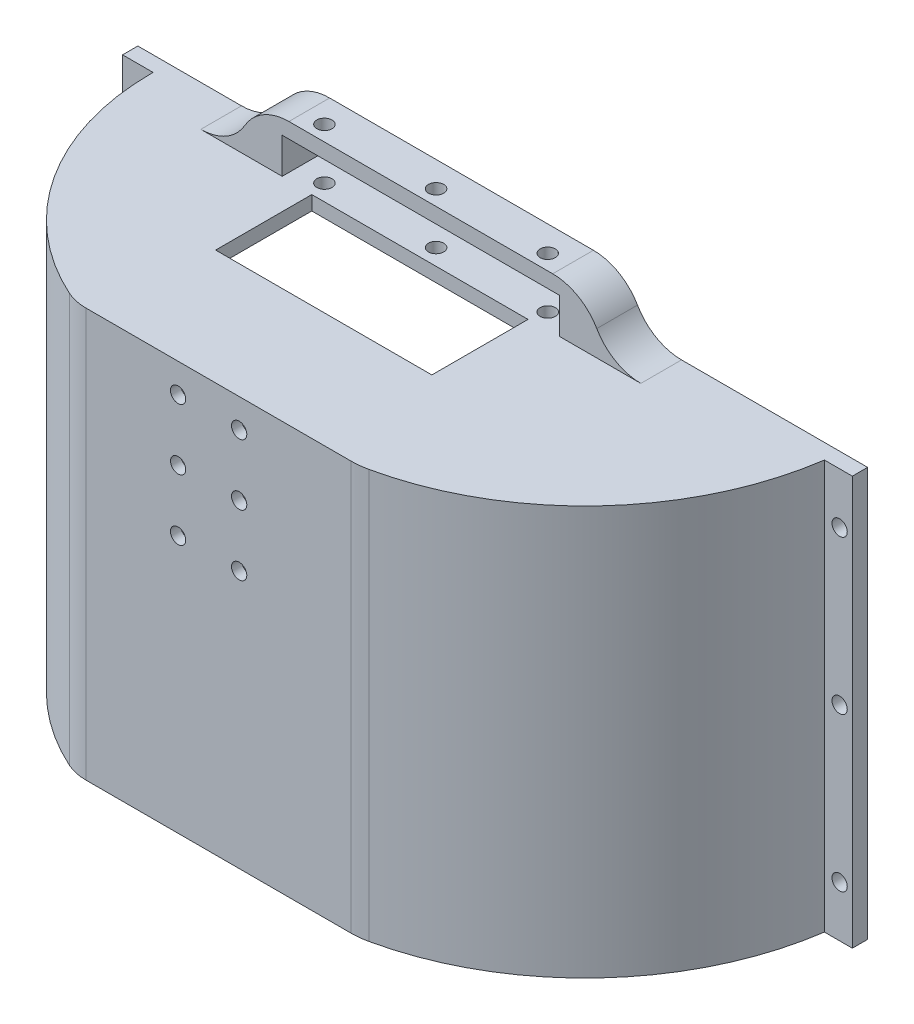
from build123d import *

# Parameters (mm, degrees)
SKETCH_1_W                  = 143.42529591
SKETCH_1_H                  = 80.35
SKETCH_1_R                  = 1.5
SKETCH_1_W_2                = 127.420983087
SKETCH_1_H_2                = 74.55
EXTRUDE_1_DEPTH             = 3
SKETCH_2_W                  = 131.42529591
SKETCH_2_H                  = 5
SKETCH_2_R                  = 1.5
EXTRUDE_2_DEPTH             = 2.8
SKETCH_3_R                  = 1.5
CUT_EXTRUDE_1_DEPTH         = 10
SKETCH_4_W                  = 6
SKETCH_4_H                  = 8
EXTRUDE_3_DEPTH             = 10
SKETCH_5_W                  = 54.485918212
SKETCH_5_H                  = 8
EXTRUDE_4_DEPTH             = 3
FILLET_1_R                  = 10
FILLET_2_R                  = 10
SKETCH_6_R                  = 1.5
CUT_EXTRUDE_2_DEPTH         = 3
EXTRUDE_5_DEPTH             = 2.8
SKETCH_8_W                  = 42.5
SKETCH_8_H                  = 8
SKETCH_8_H_2                = 10.9
SKETCH_8_R                  = 1.5
CUT_EXTRUDE_3_DEPTH         = 3
EXTRUDE_6_REACH             = 127.55
EXTRUDE_6_DIRECTION_2_DEPTH = 2.8
SKETCH_11_R                 = 1.5
SKETCH_11_R_2               = 1.490339558
CUT_EXTRUDE_4_DEPTH         = 3
EXTRUDE_START               = -3
EXTRUDE_7_DEPTH             = 3


with BuildPart() as part:
    # 草图1 → 凸台-拉伸1 (new body)
    with BuildSketch(Plane.XY):
        with Locations((-13.602517363, 6.11984421)):
            Rectangle(SKETCH_1_W, SKETCH_1_H)
        with Locations((55.610130592, -24.05515579)):
            Circle(SKETCH_1_R, mode=Mode.SUBTRACT)
        with Locations((55.610130592, 6.11984421)):
            Circle(SKETCH_1_R, mode=Mode.SUBTRACT)
        with Locations((55.610130592, 36.29484421)):
            Circle(SKETCH_1_R, mode=Mode.SUBTRACT)
        with Locations((-82.810852495, -24.05515579)):
            Circle(SKETCH_1_R, mode=Mode.SUBTRACT)
        with Locations((-82.810852495, 6.11984421)):
            Circle(SKETCH_1_R, mode=Mode.SUBTRACT)
        with Locations((-82.810852495, 36.29484421)):
            Circle(SKETCH_1_R, mode=Mode.SUBTRACT)
        with Locations((-13.600360952, 6.21984421)):
            Rectangle(SKETCH_1_W_2, SKETCH_1_H_2, mode=Mode.SUBTRACT)
    extrude(amount=EXTRUDE_1_DEPTH)

    # 草图2 → 凸台-拉伸2 (add)
    with BuildSketch(Plane(origin=(0, 46.29484421, 0), x_dir=(1, 0, 0), z_dir=(0, 1, 0))):
        with Locations((-13.602517363, -5.5)):
            Rectangle(SKETCH_2_W, SKETCH_2_H)
        with Locations(Location((-21.702517363, -5, 0), (0, 0, 180))):
            Circle(SKETCH_2_R, mode=Mode.SUBTRACT)
    extrude(amount=-EXTRUDE_2_DEPTH)

    # 草图3 → 切除-拉伸1 (cut)
    with BuildSketch(Plane(origin=(0, 46.29484421, 0), x_dir=(1, 0, 0), z_dir=(0, 1, 0))):
        with Locations(Location((0.240439338, -5, 0), (0, 0, 270))):
            Circle(SKETCH_3_R)
        with Locations(Location((-43.645478874, -5, 0), (0, 0, 270))):
            Circle(SKETCH_3_R)
    extrude(amount=-CUT_EXTRUDE_1_DEPTH, mode=Mode.SUBTRACT)

    # 草图4 → 凸台-拉伸3 (add)
    with BuildSketch(Plane(origin=(0, 46.29484421, 0), x_dir=(1, 0, 0), z_dir=(0, 1, 0))):
        with Locations((8.540439338, -4)):
            Rectangle(SKETCH_4_W, SKETCH_4_H)
        with Locations((-51.945478874, -4)):
            Rectangle(SKETCH_4_W, SKETCH_4_H)
    extrude(amount=EXTRUDE_3_DEPTH)

    # 草图5 → 凸台-拉伸4 (add)
    with BuildSketch(Plane(origin=(0, 56.29484421, 0), x_dir=(1, 0, 0), z_dir=(0, 1, 0))):
        with Locations((-21.702519768, -4)):
            Rectangle(SKETCH_5_W, SKETCH_5_H)
    extrude(amount=-EXTRUDE_4_DEPTH)

    # 圆角1
    fillet_1_edges = [part.edges().sort_by_distance(p)[0] for p in [
        (11.540439338, 46.29484421, 4),
        (-54.945478874, 46.29484421, 4),
    ]]
    fillet(fillet_1_edges, radius=FILLET_1_R - 0.0001)  # a hair under: the kernel refuses the full size

    # 圆角2
    fillet_2_edges = [part.edges().sort_by_distance(p)[0] for p in [
        (-54.945478874, 56.29484421, 4),
        (11.540439338, 56.29484421, 4),
    ]]
    fillet(fillet_2_edges, radius=FILLET_2_R)

    # 草图6 → 切除-拉伸2 (cut)
    with BuildSketch(Plane(origin=(0, 56.29484421, 0), x_dir=(1, 0, 0), z_dir=(0, 1, 0))):
        with Locations(Location((0.240439338, -5, 0), (0, 0, 270))):
            Circle(SKETCH_6_R)
        with Locations(Location((-21.702517363, -5, 0), (0, 0, 180))):
            Circle(SKETCH_6_R)
        with Locations(Location((-43.645478874, -5, 0), (0, 0, 270))):
            Circle(SKETCH_6_R)
    extrude(amount=-CUT_EXTRUDE_2_DEPTH, mode=Mode.SUBTRACT)

    # 草图7 → 凸台-拉伸5 (add)
    with BuildSketch(Plane(origin=(0, 46.29484421, 0), x_dir=(1, 0, 0), z_dir=(0, 1, 0))):
        with BuildLine():
            Line((52.110130592, -3), (-79.315165318, -3))
            ThreePointArc((-79.315165318, -3), (-71.408587337, -30.249323597), (-49.947485102, -48.808976146))
            ThreePointArc((-49.947485102, -48.808976146), (-47.931875984, -49.474706171), (-45.821160639, -49.7))
            Line((-45.821160639, -49.7), (3.801028521, -49.7))
            ThreePointArc((3.801028521, -49.7), (4.482979053, -49.676720076), (5.161754433, -49.606988694))
            ThreePointArc((5.161754433, -49.606988694), (36.42646247, -34.151078405), (52.110130592, -3))
        make_face()
    extrude(amount=-EXTRUDE_5_DEPTH)

    # 草图8 → 切除-拉伸3 (cut)
    with BuildSketch(Plane(origin=(0, 46.29484421, 0), x_dir=(1, 0, 0), z_dir=(0, 1, 0))):
        with BuildLine():
            Line((52.110130592, -8), (52.110130592, -3))
            ThreePointArc((52.110130592, -3), (51.686965751, -5.511139637), (51.148017839, -8))
            Line((51.148017839, -8), (52.110130592, -8))
        make_face()
        with BuildLine():
            ThreePointArc((-79.091069545, -8), (-79.253197971, -5.766605102), (-79.315165318, -3.528190833))
            Line((-79.315165318, -3.528190833), (-79.315165318, -8))
            Line((-79.315165318, -8), (-79.091069545, -8))
        make_face()
        with BuildLine():
            Line((-79.315165318, -3.528190833), (-79.315165318, -3))
            ThreePointArc((-79.315165318, -3), (-79.315862787, -3.264095416), (-79.315165318, -3.528190833))
        make_face()
        with Locations((-21.687503936, -23.091321672)):
            Rectangle(SKETCH_8_W, SKETCH_8_H)
        with Locations((-21.687503936, -13.641321672)):
            Rectangle(SKETCH_8_W, SKETCH_8_H_2)
        with Locations(Location((0.240439338, -5, 0), (0, 0, 270))):
            Circle(SKETCH_8_R)
        with Locations(Location((-43.645478874, -5, 0), (0, 0, 270))):
            Circle(SKETCH_8_R)
        with Locations(Location((-21.702517363, -5, 0), (0, 0, 270))):
            Circle(SKETCH_8_R)
    extrude(amount=-CUT_EXTRUDE_3_DEPTH, mode=Mode.SUBTRACT)

    # 凸台-拉伸6: up to this face of the body (flat: up to its plane)
    extrude_6_end = Plane(part.part.faces().sort_by_distance((-13.602517363, -34.05515579, 1.5))[0])
    # 草图9 → 凸台-拉伸6 (add, up to the picked face)
    with BuildSketch(Plane.XZ.offset(-43.49484421), mode=Mode.PRIVATE) as extrude_6_sk1:
        with BuildLine():
            ThreePointArc((-45.821160639, 49.7), (-47.931875984, 49.474706171), (-49.947485102, 48.808976146))
            ThreePointArc((-49.947485102, 48.808976146), (-71.265466668, 30.471277082), (-79.315165318, 3.528190833))
            Line((-79.315165318, 3.528190833), (-79.315165318, 3))
            Line((-79.315165318, 3), (-77.284463301, 3))
            Line((-77.284463301, 3), (-77.284463301, 5))
            ThreePointArc((-77.284463301, 5), (-69.179280492, 30.001857642), (-49.122220209, 46.987180917))
            ThreePointArc((-49.122220209, 46.987180917), (-47.509732915, 47.519764937), (-45.821160639, 47.7))
            Line((-45.821160639, 47.7), (3.801028521, 47.7))
            ThreePointArc((3.801028521, 47.7), (4.346588947, 47.681376061), (4.889609251, 47.625590956))
            ThreePointArc((4.889609251, 47.625590956), (34.185844829, 33.539377025), (49.748453895, 5))
            Line((49.748453895, 5), (50.110130592, 3))
            Line((50.110130592, 3), (52.615296987, 3))
            ThreePointArc((52.615296987, 3), (38.28835989, 32.947499211), (9.430945753, 49.359795972))
            ThreePointArc((9.430945753, 49.359795972), (7.851760578, 49.614706494), (6.254409581, 49.7))
            Line((6.254409581, 49.7), (-45.821160639, 49.7))
        make_face()
    extrude_6_tool1 = split(extrude(extrude_6_sk1.sketch, amount=EXTRUDE_6_REACH, mode=Mode.PRIVATE), bisect_by=extrude_6_end, keep=Keep.BOTH, mode=Mode.PRIVATE)
    add(extrude_6_tool1.solids().sort_by(Axis((-47.636477, 43.494844, 48.106717), (0, -1, 0)))[0])

    # 草图9 → 凸台-拉伸6 direction 2 (add)
    with BuildSketch(Plane.XZ.offset(-43.49484421)):
        with BuildLine():
            ThreePointArc((-45.821160639, 49.7), (-47.931875984, 49.474706171), (-49.947485102, 48.808976146))
            ThreePointArc((-49.947485102, 48.808976146), (-71.265466668, 30.471277082), (-79.315165318, 3.528190833))
            Line((-79.315165318, 3.528190833), (-79.315165318, 3))
            Line((-79.315165318, 3), (-77.284463301, 3))
            Line((-77.284463301, 3), (-77.284463301, 5))
            ThreePointArc((-77.284463301, 5), (-69.179280492, 30.001857642), (-49.122220209, 46.987180917))
            ThreePointArc((-49.122220209, 46.987180917), (-47.509732915, 47.519764937), (-45.821160639, 47.7))
            Line((-45.821160639, 47.7), (3.801028521, 47.7))
            ThreePointArc((3.801028521, 47.7), (4.346588947, 47.681376061), (4.889609251, 47.625590956))
            ThreePointArc((4.889609251, 47.625590956), (34.185844829, 33.539377025), (49.748453895, 5))
            Line((49.748453895, 5), (50.110130592, 3))
            Line((50.110130592, 3), (52.615296987, 3))
            ThreePointArc((52.615296987, 3), (38.28835989, 32.947499211), (9.430945753, 49.359795972))
            ThreePointArc((9.430945753, 49.359795972), (7.851760578, 49.614706494), (6.254409581, 49.7))
            Line((6.254409581, 49.7), (-45.821160639, 49.7))
        make_face()
    extrude(amount=-EXTRUDE_6_DIRECTION_2_DEPTH)

    # 草图11 → 切除-拉伸4 (cut)
    with BuildSketch(Plane(origin=(0, 0, 47.7), x_dir=(-1, 0, 0), z_dir=(0, 0, -1))):
        with Locations((15.702514958, 40.59484421)):
            Circle(SKETCH_11_R)
        with Locations((27.702514958, 40.59484421)):
            Circle(SKETCH_11_R)
        with Locations((15.702514958, 28.59484421)):
            Circle(SKETCH_11_R)
        with Locations((27.702514958, 28.59484421)):
            Circle(SKETCH_11_R_2)
        with Locations((27.702514958, 16.59484421)):
            Circle(SKETCH_11_R)
        with Locations((15.702514958, 16.59484421)):
            Circle(SKETCH_11_R)
    extrude(amount=-CUT_EXTRUDE_4_DEPTH, mode=Mode.SUBTRACT)

    # 草图12 → 凸台-拉伸7 (add)
    with BuildSketch(Plane.XZ.offset(34.05515579).offset(EXTRUDE_START)):
        with BuildLine():
            Line((50.110130592, 3), (-77.284463301, 3))
            Line((-77.284463301, 3), (-77.284463301, 5))
            ThreePointArc((-77.284463301, 5), (-69.179280492, 30.001857642), (-49.122220209, 46.987180917))
            ThreePointArc((-49.122220209, 46.987180917), (-47.509732915, 47.519764937), (-45.821160639, 47.7))
            Line((-45.821160639, 47.7), (3.801028521, 47.7))
            ThreePointArc((3.801028521, 47.7), (4.346588947, 47.681376061), (4.889609251, 47.625590956))
            ThreePointArc((4.889609251, 47.625590956), (34.185844829, 33.539377025), (49.748453895, 5))
            Line((49.748453895, 5), (50.110130592, 3))
        make_face()
        with BuildLine():
            Line((50.110130592, 3), (52.110130592, 3))
            Line((52.110130592, 3), (52.615296987, 3))
            ThreePointArc((52.615296987, 3), (38.28835989, 32.947499211), (9.430945753, 49.359795972))
            ThreePointArc((9.430945753, 49.359795972), (7.851760578, 49.614706494), (6.254409581, 49.7))
            Line((6.254409581, 49.7), (3.801028521, 49.7))
            Line((3.801028521, 49.7), (-45.821160639, 49.7))
            ThreePointArc((-45.821160639, 49.7), (-47.931875984, 49.474706171), (-49.947485102, 48.808976146))
            ThreePointArc((-49.947485102, 48.808976146), (-71.265466668, 30.471277082), (-79.315165318, 3.528190833))
            Line((-79.315165318, 3.528190833), (-79.315165318, 3))
            Line((-79.315165318, 3), (-77.284463301, 3))
            Line((-77.284463301, 3), (-77.284463301, 5))
            ThreePointArc((-77.284463301, 5), (-69.179280492, 30.001857642), (-49.122220209, 46.987180917))
            ThreePointArc((-49.122220209, 46.987180917), (-47.509732915, 47.519764937), (-45.821160639, 47.7))
            Line((-45.821160639, 47.7), (3.801028521, 47.7))
            ThreePointArc((3.801028521, 47.7), (4.346588947, 47.681376061), (4.889609251, 47.625590956))
            ThreePointArc((4.889609251, 47.625590956), (34.185844829, 33.539377025), (49.748453895, 5))
            Line((49.748453895, 5), (50.110130592, 3))
        make_face()
    extrude(amount=EXTRUDE_7_DEPTH)


solid = part.part
